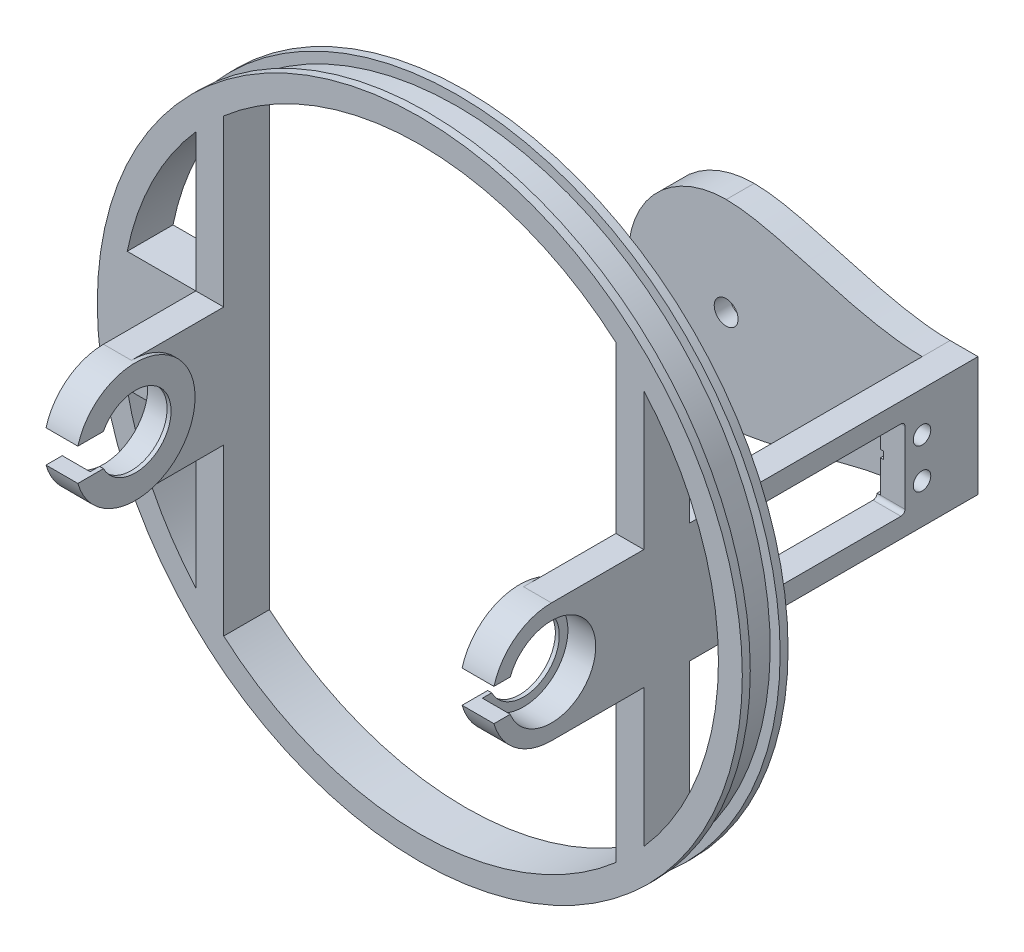
from build123d import *

# Parameters (mm, degrees)
SKETCH1_W                             = 7
SKETCH1_H                             = 2
SKETCH1_H_2                           = 22.25
BOSS_EXTRUDE1_DEPTH                   = 15
CUT_EXTRUDE1_DEPTH                    = 129.379320765
CUT_EXTRUDE1_DEPTH_BACK               = 129.379320765
SKETCH3_R                             = 11.125
CUT_EXTRUDE2_DEPTH                    = 7
SKETCH6_W                             = 34
SKETCH6_H                             = 20.3
CUT_EXTRUDE3_DEPTH                    = 7
SKETCH7_R                             = 2.2
CUT_EXTRUDE4_DEPTH                    = 10
CAVITY3_START                         = 49.25
CAVITY3_DEPTH                         = 0.842
CAVITY3_2_DEPTH                       = 6.6275
CAVITY3_START_2                       = 55.8775
CAVITY3_3_DEPTH                       = 0.3725
CAVITY3_START_3                       = -0.9135
CAVITY3_4_DEPTH                       = 1.827
CUT_EXTRUDE5_DEPTH                    = 10
CUT_EXTRUDE6_DEPTH                    = 0.842
CUT_EXTRUDE7_START                    = -7.105
SKETCH10_W                            = 0.812
SKETCH10_H                            = 1.827
CUT_EXTRUDE7_DEPTH                    = 7.105
SKETCH11_W                            = 7
SKETCH11_H                            = 30
BOSS_EXTRUDE2_DEPTH                   = 42
CAVITY4_START                         = 49.25
CAVITY4_DEPTH                         = 7
CAVITY4_2_DEPTH                       = 6.6275
CAVITY4_3_DEPTH                       = 0.842
CAVITY4_START_2                       = -0.9135
CAVITY4_4_DEPTH                       = 1.827
CUT_EXTRUDE8_DEPTH                    = 42
MIRROR3_COPY_1_SKETCH_R               = 2.2
MIRROR3_COPY_1_DEPTH                  = 10
MIRROR3_COPY_2_SKETCH_R               = 2.2
MIRROR3_COPY_2_DEPTH                  = 10
MIRROR3_COPY_3_DEPTH                  = 0.842
CUT_EXTRUDE9_DEPTH                    = 42
BOSS_EXTRUDE3_DEPTH                   = 30
BOSS_EXTRUDE6_DEPTH                   = 1
SKETCH21_R                            = 58.215655111
SKETCH21_R_2                          = 51.483613898
BOSS_EXTRUDE8_DEPTH                   = 6
CUT_EXTRUDE10_START                   = -11.527984
SKETCH21_2_R                          = 51.483613898
CUT_EXTRUDE10_DEPTH                   = 17.527984
CUT_EXTRUDE11_DEPTH                   = 139.396512432
SKETCH23_W                            = 7
SKETCH23_H                            = 30
BOSS_EXTRUDE9_DEPTH                   = 6.062483515
CUT_EXTRUDE12_DEPTH                   = 12
BOSS_EXTRUDE10_DEPTH                  = 12
BOSS_EXTRUDE12_DEPTH                  = 5.527984
SKETCH28_R                            = 78.5
SKETCH28_R_2                          = 75
BOSS_EXTRUDE13_DEPTH                  = 3.75
SKETCH29_R                            = 81
SKETCH29_R_2                          = 75
BOSS_EXTRUDE14_DEPTH                  = 2
SKETCH30_W                            = 7
SKETCH30_H                            = 30
CUT_EXTRUDE13_DEPTH                   = 11.75
SKETCH31_W                            = 7
SKETCH31_H                            = 30
BOSS_EXTRUDE15_DEPTH                  = 11.5
BOSS_EXTRUDE16_REACH                  = 163.805
BOSS_EXTRUDE16_END_RADIUS             = 75
SKETCH33_W                            = 7
SKETCH33_H                            = 11.5
BOSS_EXTRUDE16_DIRECTION_2_REACH      = 163.805
BOSS_EXTRUDE16_DIRECTION_2_END_RADIUS = 75
SKETCH34_R                            = 24.5636
BOSS_EXTRUDE17_DEPTH                  = 7
SKETCH34_3_R                          = 3
BOSS_EXTRUDE18_DEPTH                  = 4
BOSS_EXTRUDE19_DEPTH                  = 7


with BuildPart() as part:
    # Sketch1 → Boss-Extrude1 (new, symmetric)
    with BuildSketch(Plane(origin=(0, 0, 0), x_dir=(1, 0, 0), z_dir=(0, 1, 0))):
        with Locations((-52.75, -12.125)):
            Rectangle(SKETCH1_W, SKETCH1_H)
        with Locations((-52.75, 0)):
            Rectangle(SKETCH1_W, SKETCH1_H_2)
        Polygon((-49.25, 11.125), (-49.25, 53), (49.25, 53), (49.25, 11.125), (56.25, 11.125), (56.25, 60), (-56.25, 60), (-56.25, 11.125), align=None)
        with Locations((52.75, 0)):
            Rectangle(SKETCH1_W, SKETCH1_H_2)
        with Locations((52.75, -12.125)):
            Rectangle(SKETCH1_W, SKETCH1_H)
    extrude(amount=BOSS_EXTRUDE1_DEPTH, both=True)

    # Sketch2 → Cut-Extrude1 (cut, two sides: drawn at the far end of the back side and taken through both)
    with BuildSketch(Plane.ZY.offset(56.25).offset(-CUT_EXTRUDE1_DEPTH_BACK)):
        with BuildLine():
            Line((13.125, 15), (-1.875, 15))
            ThreePointArc((-1.875, 15), (7.18728448, 11.953033088), (12.567904832, 4.05))
            Line((12.567904832, 4.05), (8.486617876, 4.05))
            ThreePointArc((8.486617876, 4.05), (-13, 0), (8.486617876, -4.05))
            Line((8.486617876, -4.05), (12.567904832, -4.05))
            ThreePointArc((12.567904832, -4.05), (7.18728448, -11.953033088), (-1.875, -15))
            Line((-1.875, -15), (13.125, -15))
            Line((13.125, -15), (13.125, 15))
        make_face()
    extrude(amount=CUT_EXTRUDE1_DEPTH + CUT_EXTRUDE1_DEPTH_BACK, mode=Mode.SUBTRACT)

    # Sketch3 → Cut-Extrude2 (cut)
    with BuildSketch(Plane(origin=(0, 0, -60), x_dir=(-1, 0, 0), z_dir=(0, 0, -1))):
        Circle(SKETCH3_R)
    extrude(amount=-CUT_EXTRUDE2_DEPTH, mode=Mode.SUBTRACT)

    # Sketch6 → Cut-Extrude3 (cut)
    with BuildSketch(Plane(origin=(0, 0, -60), x_dir=(-1, 0, 0), z_dir=(0, 0, -1))):
        with Locations((-32.25, 0)):
            Rectangle(SKETCH6_W, SKETCH6_H)
    extrude(amount=-CUT_EXTRUDE3_DEPTH, mode=Mode.SUBTRACT)

    # Sketch7 → Cut-Extrude4 (cut)
    with BuildSketch(Plane.ZY.offset(-49.25)):
        with Locations((-45.160353728, 5)):
            Circle(SKETCH7_R)
    cut_extrude4 = extrude(amount=-CUT_EXTRUDE4_DEPTH, mode=Mode.SUBTRACT)

    # Cavity3: read off the stored shape, not the designer's step
    # Cavity3 outline → Cavity3 (cut)
    with BuildSketch(Plane.YZ.offset(CAVITY3_START)):
        with BuildLine():
            Line((-3.80625, -42.340467029), (-3.80625, -42.949467029))
            ThreePointArc((-3.80625, -42.949467029), (-5.075, -47.020009529), (-6.34375, -42.949467029))
            Line((-6.34375, -42.949467029), (-6.34375, -42.340467029))
            Line((-6.34375, -42.340467029), (-8.0185, -42.340467029))
            ThreePointArc((-8.0185, -42.340467029), (-8.736213383, -42.637753646), (-9.0335, -43.355467029))
            Line((-9.0335, -43.355467029), (-9.0335, -49.445467029))
            Line((-9.0335, -49.445467029), (9.0335, -49.445467029))
            Line((9.0335, -49.445467029), (9.0335, -43.355467029))
            ThreePointArc((9.0335, -43.355467029), (8.736213383, -42.637753646), (8.0185, -42.340467029))
            Line((8.0185, -42.340467029), (6.34375, -42.340467029))
            Line((6.34375, -42.340467029), (6.34375, -42.949467029))
            ThreePointArc((6.34375, -42.949467029), (7.209542976, -44.131254024), (7.156577631, -45.595293863))
            ThreePointArc((7.156577631, -45.595293863), (4.566705044, -47.317262507), (2.842761328, -44.728704204))
            ThreePointArc((2.842761328, -44.728704204), (3.111418667, -43.723695206), (3.80625, -42.949467029))
            Line((3.80625, -42.949467029), (3.80625, -42.340467029))
            Line((3.80625, -42.340467029), (-3.80625, -42.340467029))
        make_face()
    extrude(amount=CAVITY3_DEPTH, mode=Mode.SUBTRACT)

    # Cavity3 2 outline → Cavity3 2 (cut)
    with BuildSketch(Plane.YZ.offset(CAVITY3_START)):
        with BuildLine():
            ThreePointArc((10.0485, -50.460467029), (9.751213383, -49.742753646), (9.0335, -49.445467029))
            Line((9.0335, -49.445467029), (-9.0335, -49.445467029))
            ThreePointArc((-9.0335, -49.445467029), (-9.751213383, -49.742753646), (-10.0485, -50.460467029))
            Line((-10.0485, -50.460467029), (-10.0485, -60))
            Line((-10.0485, -60), (10.0485, -60))
            Line((10.0485, -60), (10.0485, -50.460467029))
        make_face()
    extrude(amount=CAVITY3_2_DEPTH, mode=Mode.SUBTRACT)

    # Cavity3 3 outline → Cavity3 3 (cut)
    with BuildSketch(Plane.YZ.offset(CAVITY3_START_2)):
        with BuildLine():
            Line((-9.744, -60), (9.744, -60))
            Line((9.744, -60), (9.744, -50.511217029))
            ThreePointArc((9.744, -50.511217029), (9.521035037, -49.972931992), (8.98275, -49.749967029))
            Line((8.98275, -49.749967029), (-8.98275, -49.749967029))
            ThreePointArc((-8.98275, -49.749967029), (-9.521035037, -49.972931992), (-9.744, -50.511217029))
            Line((-9.744, -50.511217029), (-9.744, -60))
        make_face()
    extrude(amount=CAVITY3_3_DEPTH, mode=Mode.SUBTRACT)

    # Cavity3 4 outline → Cavity3 4 (cut)
    with BuildSketch(Plane(origin=(0, 0, 0), x_dir=(1, 0, 0), z_dir=(0, 1, 0)).offset(CAVITY3_START_3)):
        Polygon((50.092, 49.445467029), (50.092, 42.340467029), (50.904, 49.445467029), align=None)
    extrude(amount=CAVITY3_4_DEPTH, mode=Mode.SUBTRACT)

    # Mirror1: Cut-Extrude4 across plane
    add(cut_extrude4.mirror(Plane.ZX), mode=Mode.SUBTRACT)

    # Sketch8 → Cut-Extrude5 (cut)
    with BuildSketch(Plane.ZY.offset(-55.8775)):
        with BuildLine():
            Line((-60, -10.0485), (-50.460467029, -10.0485))
            ThreePointArc((-50.460467029, -10.0485), (-49.742753646, -9.751213383), (-49.445467029, -9.0335))
            Line((-49.445467029, -9.0335), (-49.445467029, 9.0335))
            ThreePointArc((-49.445467029, 9.0335), (-49.742753646, 9.751213383), (-50.460467029, 10.0485))
            Line((-50.460467029, 10.0485), (-60, 10.0485))
            Line((-60, 10.0485), (-60, 9.744))
            Line((-60, 9.744), (-50.511217029, 9.744))
            ThreePointArc((-50.511217029, 9.744), (-49.972931992, 9.521035037), (-49.749967029, 8.98275))
            Line((-49.749967029, 8.98275), (-49.749967029, -8.98275))
            ThreePointArc((-49.749967029, -8.98275), (-49.972931992, -9.521035037), (-50.511217029, -9.744))
            Line((-50.511217029, -9.744), (-60, -9.744))
            Line((-60, -9.744), (-60, -10.0485))
        make_face()
    cut_extrude5 = extrude(amount=-CUT_EXTRUDE5_DEPTH, mode=Mode.SUBTRACT)

    # Sketch9 → Cut-Extrude6 (cut)
    with BuildSketch(Plane.ZY.offset(-49.25)):
        with BuildLine():
            Line((-42.340467029, 6.34375), (-42.340467029, 3.80625))
            Line((-42.340467029, 3.80625), (-42.949467029, 3.80625))
            ThreePointArc((-42.949467029, 3.80625), (-43.723695206, 3.111418667), (-44.728704204, 2.842761328))
            ThreePointArc((-44.728704204, 2.842761328), (-43.003444949, 5.433294956), (-45.595293863, 7.156577631))
            ThreePointArc((-45.595293863, 7.156577631), (-44.131254024, 7.209542976), (-42.949467029, 6.34375))
            Line((-42.949467029, 6.34375), (-42.340467029, 6.34375))
        make_face()
    cut_extrude6 = extrude(amount=-CUT_EXTRUDE6_DEPTH, mode=Mode.SUBTRACT)

    # Mirror2: Cut-Extrude6 across plane
    add(cut_extrude6.mirror(Plane.ZX), mode=Mode.SUBTRACT)

    # Sketch10 → Cut-Extrude7 (cut)
    with BuildSketch(Plane(origin=(0, 0, -49.445467029), x_dir=(-1, 0, 0), z_dir=(0, 0, -1)).offset(CUT_EXTRUDE7_START)):
        with Locations((-50.498, 0)):
            Rectangle(SKETCH10_W, SKETCH10_H)
    cut_extrude7 = extrude(amount=CUT_EXTRUDE7_DEPTH, mode=Mode.SUBTRACT)

    # Sketch11 → Boss-Extrude2 (add)
    with BuildSketch(Plane(origin=(0, 0, -60), x_dir=(-1, 0, 0), z_dir=(0, 0, -1))):
        with Locations((-52.75, 0)):
            Rectangle(SKETCH11_W, SKETCH11_H)
    extrude(amount=BOSS_EXTRUDE2_DEPTH)

    # Cavity4: read off the stored shape, not the designer's step
    # Cavity4 outline → Cavity4 (cut)
    with BuildSketch(Plane.YZ.offset(CAVITY4_START)):
        with BuildLine():
            Line((9.744, -60), (-9.744, -60))
            Line((-9.744, -60), (-9.744, -89.588717029))
            ThreePointArc((-9.744, -89.588717029), (-9.521035037, -90.127002066), (-8.98275, -90.349967029))
            Line((-8.98275, -90.349967029), (8.98275, -90.349967029))
            ThreePointArc((8.98275, -90.349967029), (9.521035037, -90.127002066), (9.744, -89.588717029))
            Line((9.744, -89.588717029), (9.744, -60))
        make_face()
    extrude(amount=CAVITY4_DEPTH, mode=Mode.SUBTRACT)

    # Cavity4 2 outline → Cavity4 2 (cut)
    with BuildSketch(Plane.YZ.offset(CAVITY4_START)):
        with BuildLine():
            Line((-9.0335, -90.654467029), (9.0335, -90.654467029))
            ThreePointArc((9.0335, -90.654467029), (9.751213383, -90.357180412), (10.0485, -89.639467029))
            Line((10.0485, -89.639467029), (10.0485, -60))
            Line((10.0485, -60), (9.744, -60))
            Line((9.744, -60), (9.744, -89.588717029))
            ThreePointArc((9.744, -89.588717029), (9.521035037, -90.127002066), (8.98275, -90.349967029))
            Line((8.98275, -90.349967029), (-8.98275, -90.349967029))
            ThreePointArc((-8.98275, -90.349967029), (-9.521035037, -90.127002066), (-9.744, -89.588717029))
            Line((-9.744, -89.588717029), (-9.744, -60))
            Line((-9.744, -60), (-10.0485, -60))
            Line((-10.0485, -60), (-10.0485, -89.639467029))
            ThreePointArc((-10.0485, -89.639467029), (-9.751213383, -90.357180412), (-9.0335, -90.654467029))
        make_face()
    extrude(amount=CAVITY4_2_DEPTH, mode=Mode.SUBTRACT)

    # Cavity4 3 outline → Cavity4 3 (cut)
    with BuildSketch(Plane.YZ.offset(CAVITY4_START)):
        with BuildLine():
            Line((-9.0335, -90.654467029), (-9.0335, -96.744467029))
            ThreePointArc((-9.0335, -96.744467029), (-8.736213383, -97.462180412), (-8.0185, -97.759467029))
            Line((-8.0185, -97.759467029), (-6.34375, -97.759467029))
            Line((-6.34375, -97.759467029), (-6.34375, -97.150467029))
            ThreePointArc((-6.34375, -97.150467029), (-5.075, -93.07992453), (-3.80625, -97.150467029))
            Line((-3.80625, -97.150467029), (-3.80625, -97.759467029))
            Line((-3.80625, -97.759467029), (3.80625, -97.759467029))
            Line((3.80625, -97.759467029), (3.80625, -97.150467029))
            ThreePointArc((3.80625, -97.150467029), (5.075, -93.07992453), (6.34375, -97.150467029))
            Line((6.34375, -97.150467029), (6.34375, -97.759467029))
            Line((6.34375, -97.759467029), (8.0185, -97.759467029))
            ThreePointArc((8.0185, -97.759467029), (8.736213383, -97.462180412), (9.0335, -96.744467029))
            Line((9.0335, -96.744467029), (9.0335, -90.654467029))
            Line((9.0335, -90.654467029), (-9.0335, -90.654467029))
        make_face()
    extrude(amount=CAVITY4_3_DEPTH, mode=Mode.SUBTRACT)

    # Cavity4 4 outline → Cavity4 4 (cut)
    with BuildSketch(Plane(origin=(0, 0, 0), x_dir=(1, 0, 0), z_dir=(0, 1, 0)).offset(CAVITY4_START_2)):
        Polygon((50.904, 90.654467029), (50.092, 97.759467029), (50.092, 90.654467029), align=None)
    extrude(amount=CAVITY4_4_DEPTH, mode=Mode.SUBTRACT)

    # Sketch12 → Cut-Extrude8 (cut)
    with BuildSketch(Plane.ZY.offset(-55.8775)):
        with BuildLine():
            Line((-60, 10.0485), (-89.639467029, 10.0485))
            ThreePointArc((-89.639467029, 10.0485), (-90.357180412, 9.751213383), (-90.654467029, 9.0335))
            Line((-90.654467029, 9.0335), (-90.654467029, -9.0335))
            ThreePointArc((-90.654467029, -9.0335), (-90.357180412, -9.751213383), (-89.639467029, -10.0485))
            Line((-89.639467029, -10.0485), (-60, -10.0485))
            Line((-60, -10.0485), (-60, -9.744))
            Line((-60, -9.744), (-89.588717029, -9.744))
            ThreePointArc((-89.588717029, -9.744), (-90.127002066, -9.521035037), (-90.349967029, -8.98275))
            Line((-90.349967029, -8.98275), (-90.349967029, 8.98275))
            ThreePointArc((-90.349967029, 8.98275), (-90.127002066, 9.521035037), (-89.588717029, 9.744))
            Line((-89.588717029, 9.744), (-60, 9.744))
            Line((-60, 9.744), (-60, 10.0485))
        make_face()
    extrude(amount=-CUT_EXTRUDE8_DEPTH, mode=Mode.SUBTRACT)

    # Mirror3: Cut-Extrude5, Cut-Extrude6, Cut-Extrude7 across plane
    add(cut_extrude5.mirror(Plane(origin=(0, 0, -70.049967029), x_dir=(1, 0, 0), z_dir=(0, 0, -1))), mode=Mode.SUBTRACT)
    add(cut_extrude6.mirror(Plane(origin=(0, 0, -70.049967029), x_dir=(1, 0, 0), z_dir=(0, 0, -1))), mode=Mode.SUBTRACT)
    add(cut_extrude7.mirror(Plane(origin=(0, 0, -70.049967029), x_dir=(1, 0, 0), z_dir=(0, 0, -1))), mode=Mode.SUBTRACT)

    # Mirror3 copy 1 sketch → Mirror3 copy 1 (cut)
    with BuildSketch(Plane(origin=(49.25, 0, -140.099934058), x_dir=(0, 0, -1), z_dir=(-1, 0, 0))):
        with Locations((-45.160353728, 5)):
            Circle(MIRROR3_COPY_1_SKETCH_R)
    extrude(amount=-MIRROR3_COPY_1_DEPTH, mode=Mode.SUBTRACT)

    # Mirror3 copy 2 sketch → Mirror3 copy 2 (cut)
    with BuildSketch(Plane(origin=(49.25, 0, -140.099934058), x_dir=(0, 0, -1), z_dir=(-1, 0, 0))):
        with Locations((-45.160353728, -5)):
            Circle(MIRROR3_COPY_2_SKETCH_R)
    extrude(amount=-MIRROR3_COPY_2_DEPTH, mode=Mode.SUBTRACT)

    # Mirror3 copy 3 sketch → Mirror3 copy 3 (cut)
    with BuildSketch(Plane(origin=(49.25, 0, -140.099934058), x_dir=(0, 0, -1), z_dir=(-1, 0, 0))):
        with BuildLine():
            Line((-42.340467029, 6.34375), (-42.340467029, 3.80625))
            Line((-42.340467029, 3.80625), (-42.949467029, 3.80625))
            ThreePointArc((-42.949467029, 3.80625), (-43.723695206, 3.111418667), (-44.728704204, 2.842761328))
            ThreePointArc((-44.728704204, 2.842761328), (-43.003444949, 5.433294956), (-45.595293863, 7.156577631))
            ThreePointArc((-45.595293863, 7.156577631), (-44.131254024, 7.209542976), (-42.949467029, 6.34375))
            Line((-42.949467029, 6.34375), (-42.340467029, 6.34375))
        make_face()
    extrude(amount=-MIRROR3_COPY_3_DEPTH, mode=Mode.SUBTRACT)

    # Sketch13 → Cut-Extrude9 (cut)
    with BuildSketch(Plane(origin=(0, 15, 0), x_dir=(1, 0, 0), z_dir=(0, 1, 0))):
        Polygon((-56.25, 60), (-56.25, 18.75), (-15, 60), align=None)
    extrude(amount=-CUT_EXTRUDE9_DEPTH, mode=Mode.SUBTRACT)


with BuildPart() as cut_extrude9_piece_1:
    # of the separate pieces the step leaves, piece 1, a body of its own (cut_extrude9_pieces)
    add(part.part.solids().sort_by_distance((49.25, -15, -60))[0])



with BuildPart() as cut_extrude9_piece_2:
    # of the separate pieces the step leaves, piece 2, a body of its own (cut_extrude9_pieces)
    add(part.part.solids().sort_by_distance((-56.25, -15, -1.875))[0])


with BuildPart() as cut_extrude9_piece_1_1:
    add(cut_extrude9_piece_1.part)

    add(cut_extrude9_piece_2.part)  # Boss-Extrude3 merges Cut-Extrude9 piece 2
    # Sketch13<3> → Boss-Extrude3 (add)
    with BuildSketch(Plane(origin=(0, 15, 0), x_dir=(1, 0, 0), z_dir=(0, 1, 0))):
        Polygon((-49.25, 25.75), (-49.25, 18.75), (-15, 53), (-22, 53), align=None)
    extrude(amount=-BOSS_EXTRUDE3_DEPTH)

    # Sketch18 → Boss-Extrude6 (add)
    with BuildSketch(Plane.ZY.offset(-49.25)):
        with BuildLine():
            Line((8.486617876, 4.05), (6.134252462, 4.05))
            ThreePointArc((6.134252462, 4.05), (-10.85, 0), (6.134252462, -4.05))
            Line((6.134252462, -4.05), (8.486617876, -4.05))
            Line((8.486617876, -4.05), (12.567904832, -4.05))
            ThreePointArc((12.567904832, -4.05), (-16.875, 0), (12.567904832, 4.05))
            Line((12.567904832, 4.05), (8.486617876, 4.05))
        make_face()
    boss_extrude6 = extrude(amount=BOSS_EXTRUDE6_DEPTH)

    # Mirror4: Boss-Extrude6 across plane
    add(boss_extrude6.mirror(Plane(origin=(0, 0, 0), x_dir=(0, 0, 1), z_dir=(1, 0, 0))))

    # Sketch21 → Boss-Extrude8 (add, symmetric)
    with BuildSketch(Plane.XY.offset(-30.812483515)):
        with Locations(Location((0, 0, 0), (0, 0, 14.931417178))):
            Circle(SKETCH21_R)
        Circle(SKETCH21_R_2, mode=Mode.SUBTRACT)
    extrude(amount=BOSS_EXTRUDE8_DEPTH, both=True)

    # Sketch21<2> → Cut-Extrude10 (cut)
    with BuildSketch(Plane.XY.offset(-30.812483515).offset(CUT_EXTRUDE10_START)):
        with Locations(Location((0, 0, 0), (0, 0, 16.939085631))):
            Circle(SKETCH21_2_R)
    extrude(amount=CUT_EXTRUDE10_DEPTH, mode=Mode.SUBTRACT)

    # Sketch22 → Cut-Extrude11 (cut, through all)
    with BuildSketch(Plane(origin=(0, 15, 0), x_dir=(1, 0, 0), z_dir=(0, 1, 0))):
        Polygon((-15, 60), (-32.659532971, 42.340467029), (-25.659532971, 42.340467029), (-15, 53), (49.25, 53), (49.25, 60), align=None)
        Polygon((-49.25, 18.75), (-56.25, 18.75), (-50.187516485, 24.812483515), (-43.187516485, 24.812483515), align=None)
    extrude(amount=-CUT_EXTRUDE11_DEPTH, mode=Mode.SUBTRACT)


with BuildPart() as cut_extrude11_piece_1:
    # of the separate pieces the step leaves, piece 1, a body of its own (cut_extrude11_pieces)
    add(cut_extrude9_piece_1_1.part.solids().sort_by_distance((49.25, 15, -24.812483515))[0])



with BuildPart() as cut_extrude11_piece_2:
    # of the separate pieces the step leaves, piece 2, a body of its own (cut_extrude11_pieces)
    add(cut_extrude9_piece_1_1.part.solids().sort_by_distance((-56.25, -15, -1.875))[0])


with BuildPart() as cut_extrude11_piece_1_1:
    add(cut_extrude11_piece_1.part)

    add(cut_extrude11_piece_2.part)  # Boss-Extrude9 merges Cut-Extrude11 piece 2
    # Sketch23 → Boss-Extrude9 (add)
    with BuildSketch(Plane(origin=(0, 0, -18.75), x_dir=(-1, 0, 0), z_dir=(0, 0, -1))):
        with Locations((52.75, 0)):
            Rectangle(SKETCH23_W, SKETCH23_H)
    extrude(amount=BOSS_EXTRUDE9_DEPTH)

    # Sketch24 → Cut-Extrude12 (cut)
    with BuildSketch(Plane.XY.offset(-24.812483515)):
        with BuildLine():
            ThreePointArc((56.25, 15), (0, 58.215655111), (-56.25, 15))
            Line((-56.25, 15), (-49.25, 15))
            ThreePointArc((-49.25, 15), (0, 51.483613898), (49.25, 15))
            Line((49.25, 15), (56.25, 15))
        make_face()
        with BuildLine():
            Line((-56.25, -15), (-56.25, 15))
            ThreePointArc((-56.25, 15), (-58.215655111, 0), (-56.25, -15))
        make_face()
        with BuildLine():
            Line((-49.25, -15), (-56.25, -15))
            ThreePointArc((-56.25, -15), (0, -58.215655111), (56.25, -15))
            Line((56.25, -15), (49.25, -15))
            ThreePointArc((49.25, -15), (0, -51.483613898), (-49.25, -15))
        make_face()
        with BuildLine():
            ThreePointArc((56.25, -15), (58.215655111, 0), (56.25, 15))
            Line((56.25, 15), (56.25, -15))
        make_face()
    extrude(amount=-CUT_EXTRUDE12_DEPTH, mode=Mode.SUBTRACT)


with BuildPart() as cut_extrude12_piece_1:
    # of the separate pieces the step leaves, piece 1, a body of its own (cut_extrude12_pieces)
    add(cut_extrude11_piece_1_1.part.solids().sort_by_distance((56.25, -15, -102))[0])



with BuildPart() as cut_extrude12_piece_2:
    # of the separate pieces the step leaves, piece 2, a body of its own (cut_extrude12_pieces)
    add(cut_extrude11_piece_1_1.part.solids().sort_by_distance((-56.25, -15, -1.875))[0])


with BuildPart() as cut_extrude12_piece_1_1:
    add(cut_extrude12_piece_1.part)

    add(cut_extrude12_piece_2.part)  # Boss-Extrude10 merges Cut-Extrude12 piece 2
    # Sketch25 → Boss-Extrude10 (add)
    with BuildSketch(Plane(origin=(0, 0, -24.812483515), x_dir=(-1, 0, 0), z_dir=(0, 0, -1))):
        with BuildLine():
            Line((49.25, 15), (49.25, -15))
            ThreePointArc((49.25, -15), (51.483613898, 0), (49.25, 15))
        make_face()
        with BuildLine():
            Line((-49.25, -15), (-49.25, 15))
            ThreePointArc((-49.25, 15), (-51.483613898, 0), (-49.25, -15))
        make_face()
    extrude(amount=BOSS_EXTRUDE10_DEPTH)

    # Sketch26 → Boss-Extrude12 (add)
    with BuildSketch(Plane(origin=(0, 0, -36.812483515), x_dir=(-1, 0, 0), z_dir=(0, 0, -1))):
        with BuildLine():
            Line((-49.25, -15), (-49.25, 15))
            ThreePointArc((-49.25, 15), (-51.483613898, 0), (-49.25, -15))
        make_face()
    extrude(amount=BOSS_EXTRUDE12_DEPTH)

    # Sketch30 → Cut-Extrude13 (cut)
    with BuildSketch(Plane(origin=(0, 0, -36.812483515), x_dir=(-1, 0, 0), z_dir=(0, 0, -1))):
        with Locations((52.75, 0)):
            Rectangle(SKETCH30_W, SKETCH30_H)
    extrude(amount=-CUT_EXTRUDE13_DEPTH, mode=Mode.SUBTRACT)



with BuildPart() as body_2:
    # Sketch28 → Boss-Extrude13 (new, symmetric)
    with BuildSketch(Plane(origin=(0, 0, -30.812483515), x_dir=(1, 0, 0), z_dir=(0, 0, -1))):
        with Locations(Location((0, 0, 0), (0, 0, 270))):
            Circle(SKETCH28_R)
        with Locations(Location((0, 0, 0), (0, 0, 270))):
            Circle(SKETCH28_R_2, mode=Mode.SUBTRACT)
    extrude(amount=BOSS_EXTRUDE13_DEPTH, both=True)

    # Sketch29 → Boss-Extrude14 (add)
    with BuildSketch(Plane.XY.offset(-27.062483515)):
        Circle(SKETCH29_R)
        Circle(SKETCH29_R_2, mode=Mode.SUBTRACT)
    boss_extrude14 = extrude(amount=BOSS_EXTRUDE14_DEPTH)

    # Mirror5: Boss-Extrude14 across plane
    add(boss_extrude14.mirror(Plane(origin=(0, 0, -30.812483515), x_dir=(1, 0, 0), z_dir=(0, 0, -1))))


with BuildPart() as cut_extrude12_piece_1_2:
    add(cut_extrude12_piece_1_1.part)

    add(body_2.part)  # Boss-Extrude15 merges body 2
    # Sketch31 → Boss-Extrude15 (add)
    with BuildSketch(Plane(origin=(0, 0, -25.062483515), x_dir=(-1, 0, 0), z_dir=(0, 0, -1))):
        with BuildLine():
            Line((49.25, 15), (56.25, 15))
            Line((56.25, 15), (56.25, 49.607837082))
            ThreePointArc((56.25, 49.607837082), (52.864525503, 53.200958106), (49.25, 56.563570432))
            Line((49.25, 56.563570432), (49.25, 15))
        make_face()
        with Locations((52.75, 0)):
            Rectangle(SKETCH31_W, SKETCH31_H)
        with BuildLine():
            Line((56.25, -49.607837082), (56.25, -15))
            Line((56.25, -15), (49.25, -15))
            Line((49.25, -15), (49.25, -56.563570432))
            ThreePointArc((49.25, -56.563570432), (52.864525503, -53.200958106), (56.25, -49.607837082))
        make_face()
        with BuildLine():
            Line((73.484692283, 15), (56.25, 15))
            Line((56.25, 15), (56.25, -15))
            Line((56.25, -15), (73.484692283, -15))
            ThreePointArc((73.484692283, -15), (75, 0), (73.484692283, 15))
        make_face()
    extrude(amount=BOSS_EXTRUDE15_DEPTH)

    # Boss-Extrude16: up to this cylinder (the profile starts inside it)
    boss_extrude16_end = Plane(origin=(0, 0, -30.812484), z_dir=(0, 0, 1)) * Cylinder(BOSS_EXTRUDE16_END_RADIUS, 478.61, mode=Mode.PRIVATE)
    # Sketch33 → Boss-Extrude16 (add, up to the surface)
    with BuildSketch(Plane(origin=(0, 15, 0), x_dir=(1, 0, 0), z_dir=(0, 1, 0)), mode=Mode.PRIVATE) as boss_extrude16_sk1:
        with Locations((52.75, 30.812483515)):
            Rectangle(SKETCH33_W, SKETCH33_H)
    boss_extrude16_tool1 = extrude(boss_extrude16_sk1.sketch, amount=BOSS_EXTRUDE16_REACH, mode=Mode.PRIVATE) & boss_extrude16_end
    add(boss_extrude16_tool1.solids().sort_by_distance((52.75, 15, -30.812484))[0])

    # Boss-Extrude16 direction 2: up to this cylinder (the profile starts inside it)
    boss_extrude16_direction_2_end = Plane(origin=(0, 0, -30.812484), z_dir=(0, 0, 1)) * Cylinder(BOSS_EXTRUDE16_DIRECTION_2_END_RADIUS, 478.61, mode=Mode.PRIVATE)
    # Sketch33 → Boss-Extrude16 direction 2 (add, up to the surface)
    with BuildSketch(Plane(origin=(0, 15, 0), x_dir=(1, 0, 0), z_dir=(0, 1, 0)), mode=Mode.PRIVATE) as boss_extrude16_direction_2_sk1:
        with Locations((52.75, 30.812483515)):
            Rectangle(SKETCH33_W, SKETCH33_H)
    boss_extrude16_direction_2_tool1 = extrude(boss_extrude16_direction_2_sk1.sketch, amount=-BOSS_EXTRUDE16_DIRECTION_2_REACH, mode=Mode.PRIVATE) & boss_extrude16_direction_2_end
    add(boss_extrude16_direction_2_tool1.solids().sort_by_distance((52.75, 15, -30.812484))[0])



with BuildPart() as body_2_2:
    # Sketch34 → Boss-Extrude17 (new body)
    with BuildSketch(Plane(origin=(0, 0, -102), x_dir=(-1, 0, 0), z_dir=(0, 0, -1))):
        Circle(SKETCH34_R)
        with BuildLine():
            ThreePointArc((-14.057334707, -10.478794609), (-13.728227984, -13.938084566), (-10.264343631, -14.214677111))
            Line((-10.264343631, -14.214677111), (0.052139321, -6.873755028))
            Line((0.052139321, -6.873755028), (10.478794609, -14.057334707))
            ThreePointArc((10.478794609, -14.057334707), (13.938084566, -13.728227984), (14.214677111, -10.264343631))
            Line((14.214677111, -10.264343631), (6.873755028, 0.052139321))
            Line((6.873755028, 0.052139321), (14.057334707, 10.478794609))
            ThreePointArc((14.057334707, 10.478794609), (13.728227984, 13.938084566), (10.264343631, 14.214677111))
            Line((10.264343631, 14.214677111), (-0.052139321, 6.873755028))
            Line((-0.052139321, 6.873755028), (-10.478794609, 14.057334707))
            ThreePointArc((-10.478794609, 14.057334707), (-13.938084566, 13.728227984), (-14.214677111, 10.264343631))
            Line((-14.214677111, 10.264343631), (-6.873755028, -0.052139321))
            Line((-6.873755028, -0.052139321), (-14.057334707, -10.478794609))
        make_face(mode=Mode.SUBTRACT)
    extrude(amount=BOSS_EXTRUDE17_DEPTH)

    # Sketch34<3> → Boss-Extrude18 (add)
    with BuildSketch(Plane(origin=(0, 0, -102), x_dir=(-1, 0, 0), z_dir=(0, 0, -1))):
        with BuildLine():
            Line((-6.873755028, -0.052139321), (-14.057334707, -10.478794609))
            ThreePointArc((-14.057334707, -10.478794609), (-13.728227984, -13.938084566), (-10.264343631, -14.214677111))
            Line((-10.264343631, -14.214677111), (0.052139321, -6.873755028))
            Line((0.052139321, -6.873755028), (10.478794609, -14.057334707))
            ThreePointArc((10.478794609, -14.057334707), (13.938084566, -13.728227984), (14.214677111, -10.264343631))
            Line((14.214677111, -10.264343631), (6.873755028, 0.052139321))
            Line((6.873755028, 0.052139321), (14.057334707, 10.478794609))
            ThreePointArc((14.057334707, 10.478794609), (13.728227984, 13.938084566), (10.264343631, 14.214677111))
            Line((10.264343631, 14.214677111), (-0.052139321, 6.873755028))
            Line((-0.052139321, 6.873755028), (-10.478794609, 14.057334707))
            ThreePointArc((-10.478794609, 14.057334707), (-13.938084566, 13.728227984), (-14.214677111, 10.264343631))
            Line((-14.214677111, 10.264343631), (-6.873755028, -0.052139321))
        make_face()
        Circle(SKETCH34_3_R, mode=Mode.SUBTRACT)
    extrude(amount=BOSS_EXTRUDE18_DEPTH)


with BuildPart() as cut_extrude12_piece_1_3:
    add(cut_extrude12_piece_1_2.part)

    add(body_2_2.part)  # Boss-Extrude19 merges body 2 2
    # Sketch35 → Boss-Extrude19 (add)
    with BuildSketch(Plane(origin=(0, 0, -102), x_dir=(-1, 0, 0), z_dir=(0, 0, -1))):
        with BuildLine():
            Line((-49.25, 15), (-56.25, 15))
            Line((-56.25, 15), (-56.25, -15))
            Line((-56.25, -15), (-49.25, -15))
            add(Edge.make_bspline(
                [(-49.25, -15), (-32.444141428, -15), (-13.2620985, -24.547410977), (-0.0300187, -24.563581657)],
                knots=[0, 0, 0, 0, 1, 1, 1, 1], degree=3))
            ThreePointArc((-0.0300187, -24.563581657), (-24.5636, 0), (-0.0300187, 24.563581657))
            add(Edge.make_bspline(
                [(-49.25, 15), (-32.444141428, 15), (-13.2620985, 24.547410977), (-0.0300187, 24.563581657)],
                knots=[0, 0, 0, 0, 1, 1, 1, 1], degree=3))
        make_face()
    extrude(amount=BOSS_EXTRUDE19_DEPTH)


solid = cut_extrude12_piece_1_3.part
